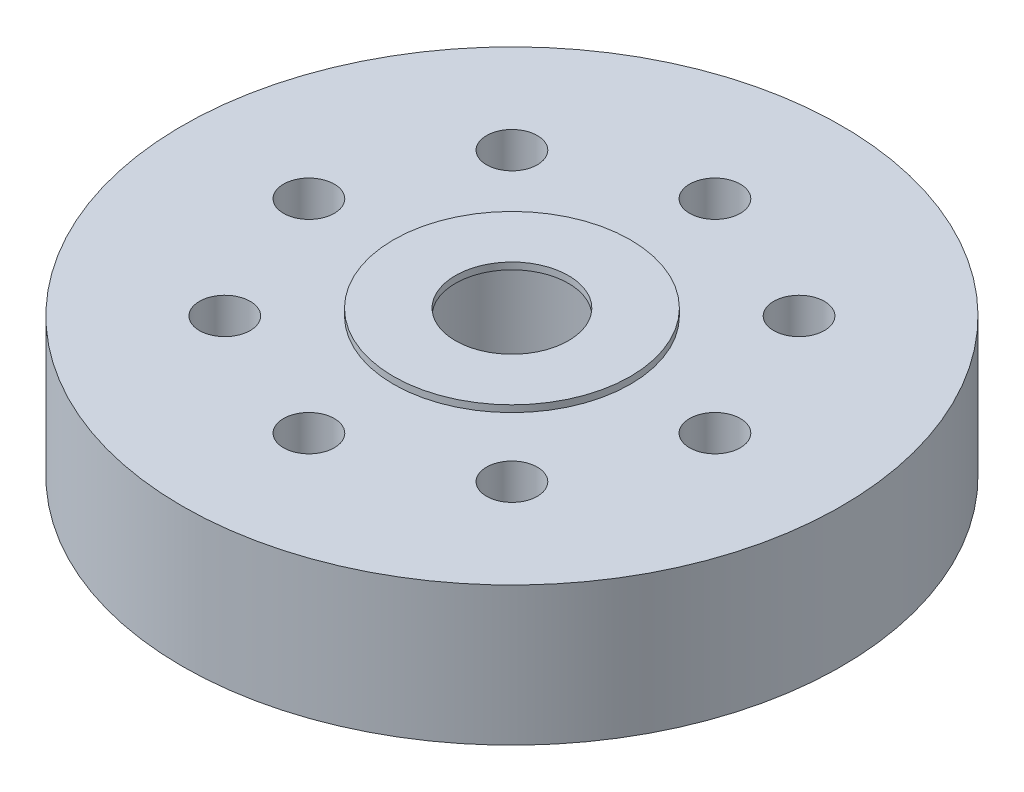
from build123d import *

# Parameters (mm, degrees)
SKETCH1_R        = 9.74
SKETCH1_R_2      = 2.57
MOUNTBODY_DEPTH  = 4.1
SKETCH2_R        = 3.5
SKETCH2_R_2      = 1.67
CAP_DEPTH        = 0.2
SKETCH3_R        = 0.75
SCREWHOLES_DEPTH = 15.371680486


with BuildPart() as part:
    # Sketch1 → MountBody (new body)
    with BuildSketch(Plane(origin=(0, 0, 0), x_dir=(1, 0, 0), z_dir=(0, 1, 0))):
        Circle(SKETCH1_R)
        Circle(SKETCH1_R_2, mode=Mode.SUBTRACT)
    extrude(amount=MOUNTBODY_DEPTH)

    # Sketch2 → Cap (add)
    with BuildSketch(Plane(origin=(0, 4.1, 0), x_dir=(1, 0, 0), z_dir=(0, 1, 0))):
        Circle(SKETCH2_R)
        Circle(SKETCH2_R_2, mode=Mode.SUBTRACT)
    extrude(amount=CAP_DEPTH)

    # Sketch3 → ScrewHoles (cut, through all)
    with BuildSketch(Plane(origin=(0, 4.1, 0), x_dir=(1, 0, 0), z_dir=(0, 1, 0))):
        with Locations((6, 0)):
            Circle(SKETCH3_R)
        with Locations((4.242640687, -4.242640687)):
            Circle(SKETCH3_R)
        with Locations((0, -6)):
            Circle(SKETCH3_R)
        with Locations((-4.242640687, -4.242640687)):
            Circle(SKETCH3_R)
        with Locations((-6, 0)):
            Circle(SKETCH3_R)
        with Locations((-4.242640687, 4.242640687)):
            Circle(SKETCH3_R)
        with Locations((0, 6)):
            Circle(SKETCH3_R)
        with Locations((4.242640687, 4.242640687)):
            Circle(SKETCH3_R)
    extrude(amount=-SCREWHOLES_DEPTH, mode=Mode.SUBTRACT)


solid = part.part
